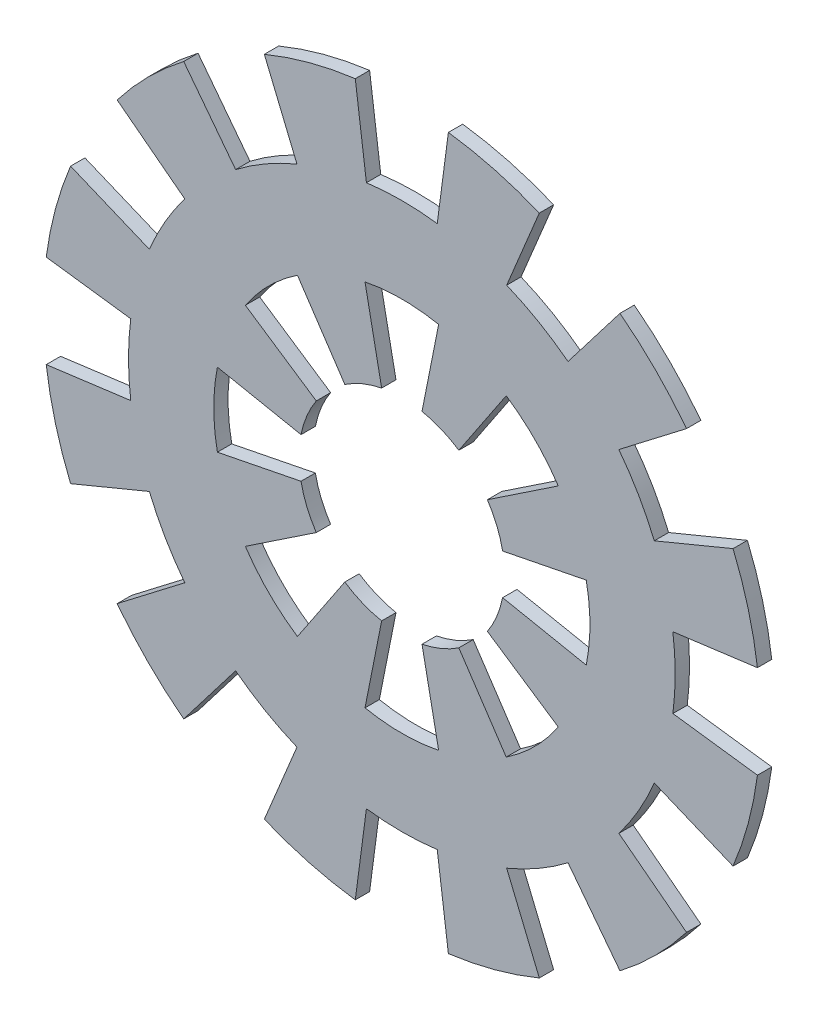
from build123d import *

# Parameters (mm, degrees)
BODYSKE_W        = 5.35
BODYSKE_H        = 0.3
TOOTHCUTIN_DEPTH = 11.61084351
TOOTHINPAT_COUNT = 8
TOOTHCUTEX_DEPTH = 11.61084351
TOOTHEXPAT_COUNT = 12


with BuildPart() as part:
    # BodySke → BaseBody (revolve)
    with BuildSketch(Plane(origin=(0, 0, 0), x_dir=(1, 0, 0), z_dir=(0, 1, 0))):
        with Locations((4.825, 0.15)):
            Rectangle(BODYSKE_W, BODYSKE_H)
    revolve(axis=Axis((0, 0, 0), (0, 0, -1)))

    # ToothInSke → ToothCutIn (cut, through all)
    with BuildSketch(Plane.XY):
        with BuildLine():
            Line((-0.770062744, 3.857215898), (-0.422151513, 2.108148026))
            Line((-0.422151513, 2.108148026), (0.422151513, 2.108148026))
            Line((0.422151513, 2.108148026), (0.770062744, 3.857215898))
            ThreePointArc((0.770062744, 3.857215898), (0, 3.933333333), (-0.770062744, 3.857215898))
        make_face()
    toothcutin = extrude(amount=-TOOTHCUTIN_DEPTH, mode=Mode.SUBTRACT)

    # ToothInPat: ToothCutIn ×8 about axis
    toothinpat_axis = Axis((0, 0, 0), (0, 0, -1))
    for i in range(1, TOOTHINPAT_COUNT):
        add(toothcutin.rotate(toothinpat_axis, i * 360 / TOOTHINPAT_COUNT), mode=Mode.SUBTRACT)

    # ToothExSke → ToothCutEx (cut, through all)
    with BuildSketch(Plane.XY):
        with BuildLine():
            Line((7.5, -0.981747704), (7.5, 0.981747704))
            Line((7.5, 0.981747704), (5.668487723, 0.740624539))
            ThreePointArc((5.668487723, 0.740624539), (5.716666667, 0), (5.668487723, -0.740624539))
            Line((5.668487723, -0.740624539), (7.5, -0.981747704))
        make_face()
    toothcutex = extrude(amount=-TOOTHCUTEX_DEPTH, mode=Mode.SUBTRACT)

    # ToothExPat: ToothCutEx ×12 about axis
    toothexpat_axis = Axis((0, 0, 0), (0, 0, -1))
    for i in range(1, TOOTHEXPAT_COUNT):
        add(toothcutex.rotate(toothexpat_axis, i * 360 / TOOTHEXPAT_COUNT), mode=Mode.SUBTRACT)


solid = part.part
